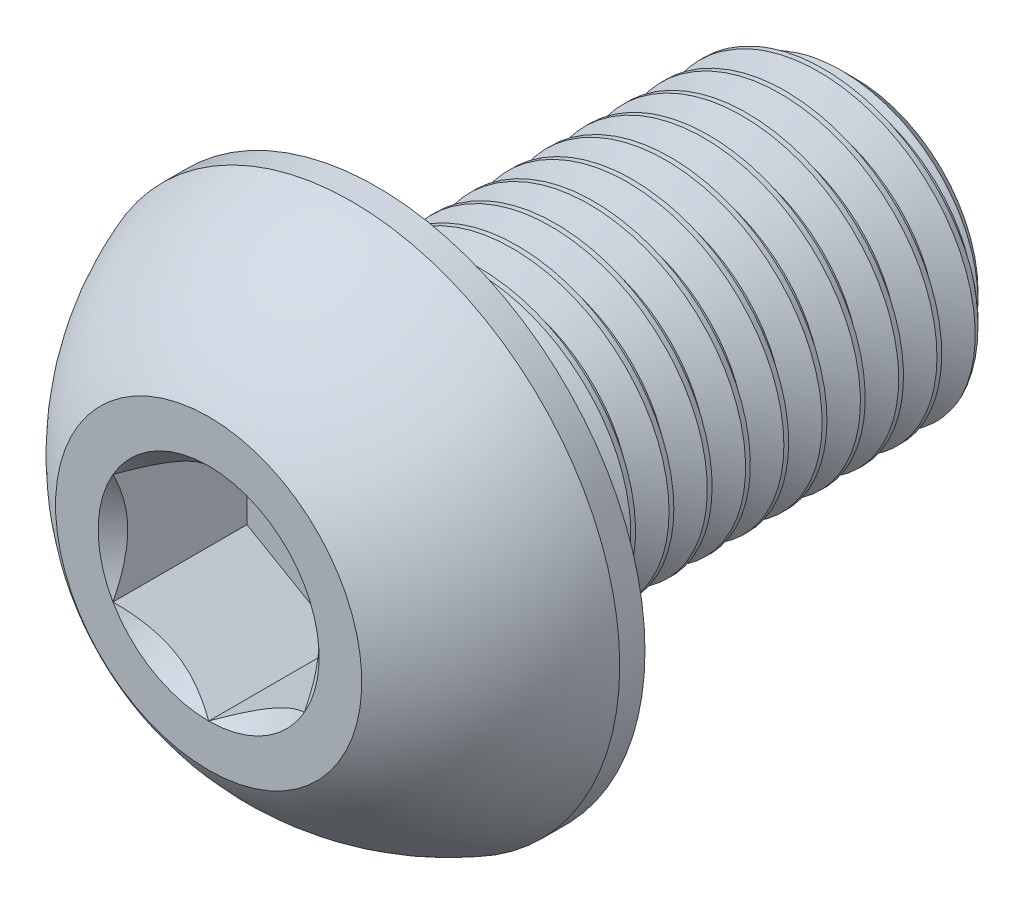
from build123d import *

# Parameters (mm, degrees)
CUT_EXTRUDE1_DEPTH  = 7
CUT_SWEEP1_PITCH    = 2
CUT_SWEEP1_TO       = 25
SKETCH7_R           = 8
BOSS_EXTRUDE1_DEPTH = 10
BOSS_EXTRUDE1_TAPER = 30


with BuildPart() as part:
    # Sketch2 → Revolve1 (revolve)
    with BuildSketch(Plane(origin=(0, 0, 0), x_dir=(0, 0, -1), z_dir=(1, 0, 0)), mode=Mode.PRIVATE) as revolve1_sk:
        with BuildLine():
            Line((-16.9, 0), (16.9, 0))
            Line((16.9, 0), (16.9, 6.4))
            Line((16.9, 6.4), (15.3, 8))
            Line((15.3, 8), (-8.1, 8))
            Line((-8.1, 8), (-8.1, 14))
            Line((-8.1, 14), (-9.42, 14))
            ThreePointArc((-9.42, 14), (-13.656055948, 11.618416415), (-16.9, 8))
            Line((-16.9, 8), (-16.9, 0))
        make_face()
    revolve(revolve1_sk.sketch.rotate(Axis((0, 0, 16.9), (0, 0, -1)), 90), axis=Axis((0, 0, 16.9), (0, 0, -1)))

    # Sketch3 → Cut-Extrude1 (cut)
    with BuildSketch(Plane.XY.offset(16.9)):
        Polygon((0, 5.773502692), (-5, 2.886751346), (-5, -2.886751346), (0, -5.773502692), (5, -2.886751346), (5, 2.886751346), align=None)
    extrude(amount=-CUT_EXTRUDE1_DEPTH, mode=Mode.SUBTRACT)

    # Cut-Extrude2 cone 1 section (through the dimple's axis) → Cut-Extrude2 (revolve, cut)
    with BuildSketch(Plane(origin=(0, 0, 16.9), x_dir=(0, -1, 0), z_dir=(1, 0, 0))):
        Polygon((0, 0), (5.773502692, 0), (0, 5.773502692), align=None)
    revolve(axis=Axis((0, 0, 16.9), (0, 0, -1)), mode=Mode.SUBTRACT)


with BuildPart() as body_2:
    # Split1: read off the stored shape, not the designer's step
    # Split1: the piece on the far side of the plane
    add(part.part)
    split(bisect_by=Plane.XY.offset(8.1), keep=Keep.BOTTOM)

    # Cut-Sweep1: arcs per turn and ends read off the stored shape
    # Cut-Sweep1: the profile of Sketch6 screwed along a right-hand helix through 13.5 turns, 10 arcs to a turn; built about Z, then put on its axis
    cut_sweep1_z = Axis((0, 0, 0), (0, 0, 1))
    cut_sweep1_corners = [(6.700961894, 0, -0.75), (6.700961894, 0, -1), (8.108253175, 0, -1.8125), (8.108253175, 0, 0.0625)]
    with BuildLine(mode=Mode.PRIVATE) as cut_sweep1_profile:
        Line(cut_sweep1_corners[0], cut_sweep1_corners[1])
        Line(cut_sweep1_corners[1], cut_sweep1_corners[2])
        Line(cut_sweep1_corners[2], cut_sweep1_corners[3])
        Line(cut_sweep1_corners[3], cut_sweep1_corners[0])
    cut_sweep1_cap = Face(cut_sweep1_profile.wire())
    cut_sweep1_turn_angles = [0, 18, 36, 54, 72, 90, 108, 126, 144, 162, 180, 198, 216, 234, 252, 270, 288, 306, 324, 342, 360]
    cut_sweep1_turn_weights = [1, 0.9510565162951535, 1, 0.9510565162951535, 1, 0.9510565162951535, 1, 0.9510565162951535, 1, 0.9510565162951535, 1, 0.9510565162951535, 1, 0.9510565162951535, 1, 0.9510565162951535, 1, 0.9510565162951535, 1, 0.9510565162951535, 1]
    cut_sweep1_turn_rails = [Edge.make_bspline([Vector(p[0], p[1], 0).rotate(cut_sweep1_z, cut_sweep1_turn_angles[k]) / cut_sweep1_turn_weights[k] + Vector(0, 0, p[2] + CUT_SWEEP1_PITCH * cut_sweep1_turn_angles[k] / 360) for k in range(21)], [0, 0, 0, 1, 1, 2, 2, 3, 3, 4, 4, 5, 5, 6, 6, 7, 7, 8, 8, 9, 9, 10, 10, 10], 2, cut_sweep1_turn_weights) for p in cut_sweep1_corners]
    cut_sweep1_turn_sides = [Face.make_surface_from_curves(cut_sweep1_turn_rails[p[0]], cut_sweep1_turn_rails[p[1]]) for p in [(0, 1), (1, 2), (2, 3), (3, 0)]]
    cut_sweep1_last_angles = [4680, 4698, 4716, 4734, 4752, 4770, 4788, 4806, 4824, 4842, 4860]
    cut_sweep1_last_weights = [1, 0.9510565162951535, 1, 0.9510565162951535, 1, 0.9510565162951535, 1, 0.9510565162951535, 1, 0.9510565162950456, 1]
    cut_sweep1_last_rails = [Edge.make_bspline([Vector(p[0], p[1], 0).rotate(cut_sweep1_z, cut_sweep1_last_angles[k]) / cut_sweep1_last_weights[k] + Vector(0, 0, p[2] + CUT_SWEEP1_PITCH * cut_sweep1_last_angles[k] / 360) for k in range(11)], [0, 0, 0, 1, 1, 2, 2, 3, 3, 4, 4, 5, 5, 5], 2, cut_sweep1_last_weights) for p in cut_sweep1_corners]
    cut_sweep1_last_sides = [Face.make_surface_from_curves(cut_sweep1_last_rails[p[0]], cut_sweep1_last_rails[p[1]]) for p in [(0, 1), (1, 2), (2, 3), (3, 0)]]
    cut_sweep1 = Plane(origin=(0, 0, -16.9), x_dir=(0, 1, 0), z_dir=(0, 0, 1)) * split(Solid(Shell([*[p.moved(Location((0, 0, CUT_SWEEP1_PITCH * i))) for i in range(13) for p in cut_sweep1_turn_sides], *cut_sweep1_last_sides, cut_sweep1_cap, cut_sweep1_cap.rotate(cut_sweep1_z, 4860).moved(Location((0, 0, CUT_SWEEP1_PITCH * 4860 / 360)))])), bisect_by=Plane.XY.offset(CUT_SWEEP1_TO), keep=Keep.BOTTOM, mode=Mode.PRIVATE)
    add(cut_sweep1, mode=Mode.SUBTRACT)


with BuildPart() as part_1:
    add(part.part)

    # Split1
    split(bisect_by=Plane.XY.offset(8.1), keep=Keep.TOP)

    add(body_2.part)  # Boss-Extrude1 merges body 2
    # Sketch7 → Boss-Extrude1 (add)
    with BuildSketch(Plane(origin=(0, 0, 8.1), x_dir=(-1, 0, 0), z_dir=(0, 0, -1))):
        Circle(SKETCH7_R)
    extrude(amount=BOSS_EXTRUDE1_DEPTH, taper=BOSS_EXTRUDE1_TAPER)


solid = part_1.part
